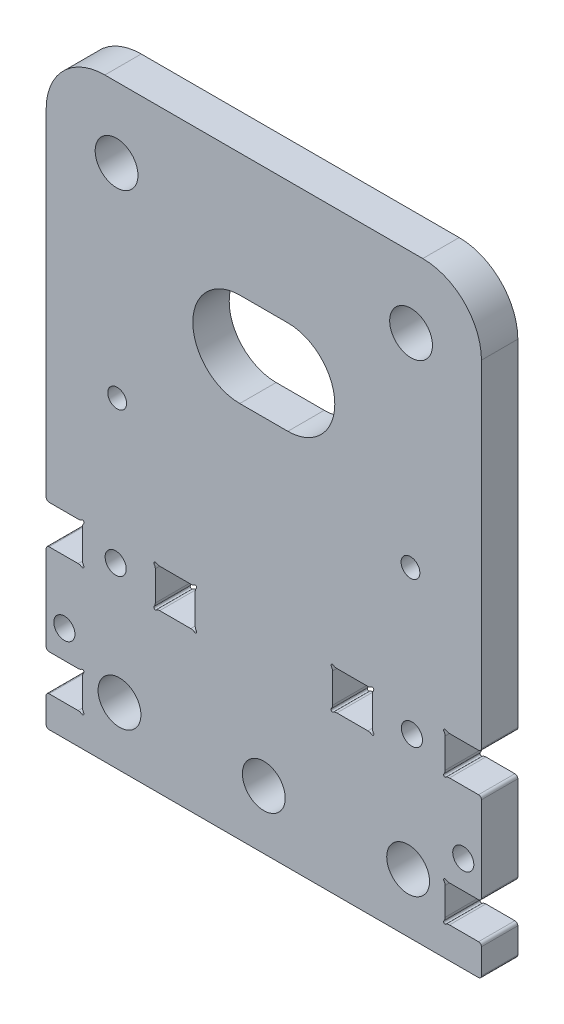
from build123d import *

# Parameters (mm, degrees)
SKETCH1_R           = 3.65
SKETCH1_R_2         = 1.8
SKETCH1_W           = 6.8
SKETCH1_H           = 6.56
SKETCH1_R_3         = 1.6
BOSS_EXTRUDE1_DEPTH = 6.2
CUT_EXTRUDE1_DEPTH  = 126.801589815
SKETCH3_R           = 0.25
CUT_EXTRUDE2_DEPTH  = 126.801589815
FILLET1_R           = 1
FILLET2_R           = 0.5


with BuildPart() as part:
    # Sketch1 → Boss-Extrude1 (new body)
    with BuildSketch(Plane.XY):
        with BuildLine():
            Line((0, 5.3), (0, 0))
            Line((0, 0), (74.2, 0))
            Line((74.2, 0), (74.2, 5.3))
            Line((74.2, 5.3), (68, 5.3))
            Line((68, 5.3), (68, 11.5))
            Line((68, 11.5), (74.2, 11.5))
            Line((74.2, 11.5), (74.2, 27))
            Line((74.2, 27), (68, 27))
            Line((68, 27), (68, 33.56))
            Line((68, 33.56), (74.2, 33.56))
            Line((74.2, 33.56), (74.2, 91.4))
            ThreePointArc((74.2, 91.4), (71.271067812, 98.471067812), (64.2, 101.4))
            Line((64.2, 101.4), (10, 101.4))
            ThreePointArc((10, 101.4), (2.928932188, 98.471067812), (0, 91.4))
            Line((0, 91.4), (0, 33.56))
            Line((0, 33.56), (6.2, 33.56))
            Line((6.2, 33.56), (6.2, 27))
            Line((6.2, 27), (0, 27))
            Line((0, 27), (0, 11.5))
            Line((0, 11.5), (6.2, 11.5))
            Line((6.2, 11.5), (6.2, 5.3))
            Line((6.2, 5.3), (0, 5.3))
        make_face()
        with Locations((12.5, 10)):
            Circle(SKETCH1_R, mode=Mode.SUBTRACT)
        with Locations((3.1, 16.28)):
            Circle(SKETCH1_R_2, mode=Mode.SUBTRACT)
        with Locations((11.85, 30.28)):
            Circle(SKETCH1_R_2, mode=Mode.SUBTRACT)
        with Locations((22, 30.28)):
            Rectangle(SKETCH1_W, SKETCH1_H, mode=Mode.SUBTRACT)
        with Locations((37.1, 10)):
            Circle(SKETCH1_R, mode=Mode.SUBTRACT)
        with Locations((61.7, 10)):
            Circle(SKETCH1_R, mode=Mode.SUBTRACT)
        with Locations((71.1, 16.28)):
            Circle(SKETCH1_R_2, mode=Mode.SUBTRACT)
        with Locations((52.2, 30.28)):
            Rectangle(SKETCH1_W, SKETCH1_H, mode=Mode.SUBTRACT)
        with Locations((62.35, 30.28)):
            Circle(SKETCH1_R_2, mode=Mode.SUBTRACT)
        with Locations((12.1, 54.75)):
            Circle(SKETCH1_R_3, mode=Mode.SUBTRACT)
        with Locations((12, 89.4)):
            Circle(SKETCH1_R, mode=Mode.SUBTRACT)
        with Locations((62.1, 54.75)):
            Circle(SKETCH1_R_3, mode=Mode.SUBTRACT)
        with Locations((62.2, 89.4)):
            Circle(SKETCH1_R, mode=Mode.SUBTRACT)
    extrude(amount=BOSS_EXTRUDE1_DEPTH)

    # Sketch2 → Cut-Extrude1 (cut, through all)
    with BuildSketch(Plane.XY.offset(6.2)):
        with BuildLine():
            Line((33, 80.4), (41.2, 80.4))
            ThreePointArc((41.2, 80.4), (49.2, 72.4), (41.2, 64.4))
            Line((41.2, 64.4), (33, 64.4))
            ThreePointArc((33, 64.4), (25, 72.4), (33, 80.4))
        make_face()
    extrude(amount=-CUT_EXTRUDE1_DEPTH, mode=Mode.SUBTRACT)

    # Sketch3 → Cut-Extrude2 (cut, through all)
    with BuildSketch(Plane.XY.offset(6.2)):
        with Locations((6.2, 33.56)):
            Circle(SKETCH3_R)
        with Locations((6.2, 27)):
            Circle(SKETCH3_R)
        with Locations((6.2, 11.5)):
            Circle(SKETCH3_R)
        with Locations((6.2, 5.3)):
            Circle(SKETCH3_R)
        with Locations((25.4, 27)):
            Circle(SKETCH3_R)
        with Locations((18.6, 27)):
            Circle(SKETCH3_R)
        with Locations((18.6, 33.56)):
            Circle(SKETCH3_R)
        with Locations((25.4, 33.56)):
            Circle(SKETCH3_R)
        with Locations((48.8, 33.56)):
            Circle(SKETCH3_R)
        with Locations((48.8, 27)):
            Circle(SKETCH3_R)
        with Locations((55.6, 33.56)):
            Circle(SKETCH3_R)
        with Locations((55.6, 27)):
            Circle(SKETCH3_R)
        with Locations((68, 33.56)):
            Circle(SKETCH3_R)
        with Locations((68, 27)):
            Circle(SKETCH3_R)
        with Locations((68, 11.5)):
            Circle(SKETCH3_R)
        with Locations((68, 5.3)):
            Circle(SKETCH3_R)
    extrude(amount=-CUT_EXTRUDE2_DEPTH, mode=Mode.SUBTRACT)

    # Fillet1
    fillet1_edges = [part.edges().sort_by_distance(p)[0] for p in [
        (5.95, 11.5, 3.1),
        (6.2, 11.25, 3.1),
        (6.2, 5.55, 3.1),
        (5.95, 5.3, 3.1),
        (68, 5.55, 3.1),
        (68.25, 5.3, 3.1),
        (68, 11.25, 3.1),
        (68.25, 11.5, 3.1),
        (68.25, 33.56, 3.1),
        (68, 33.31, 3.1),
        (68, 27.25, 3.1),
        (68.25, 27, 3.1),
        (48.8, 27.25, 3.1),
        (48.8, 33.31, 3.1),
        (49.05, 33.56, 3.1),
        (55.35, 33.56, 3.1),
        (55.6, 33.31, 3.1),
        (55.6, 27.25, 3.1),
        (55.35, 27, 3.1),
        (49.05, 27, 3.1),
        (18.6, 27.25, 3.1),
        (18.85, 27, 3.1),
        (25.15, 27, 3.1),
        (25.4, 27.25, 3.1),
        (25.4, 33.31, 3.1),
        (25.15, 33.56, 3.1),
        (18.85, 33.56, 3.1),
        (18.6, 33.31, 3.1),
        (5.95, 33.56, 3.1),
        (6.2, 33.31, 3.1),
        (6.2, 27.25, 3.1),
        (5.95, 27, 3.1),
    ]]
    fillet(fillet1_edges, radius=FILLET1_R)

    # Fillet2
    fillet2_edges = [part.edges().sort_by_distance(p)[0] for p in [
        (0, 0, 3.1),
        (74.2, 0, 3.1),
        (74.2, 33.56, 3.1),
        (74.2, 27, 3.1),
        (74.2, 5.3, 3.1),
        (74.2, 11.5, 3.1),
        (0, 5.3, 3.1),
        (0, 11.5, 3.1),
        (0, 33.56, 3.1),
        (0, 27, 3.1),
    ]]
    fillet(fillet2_edges, radius=FILLET2_R)


solid = part.part
